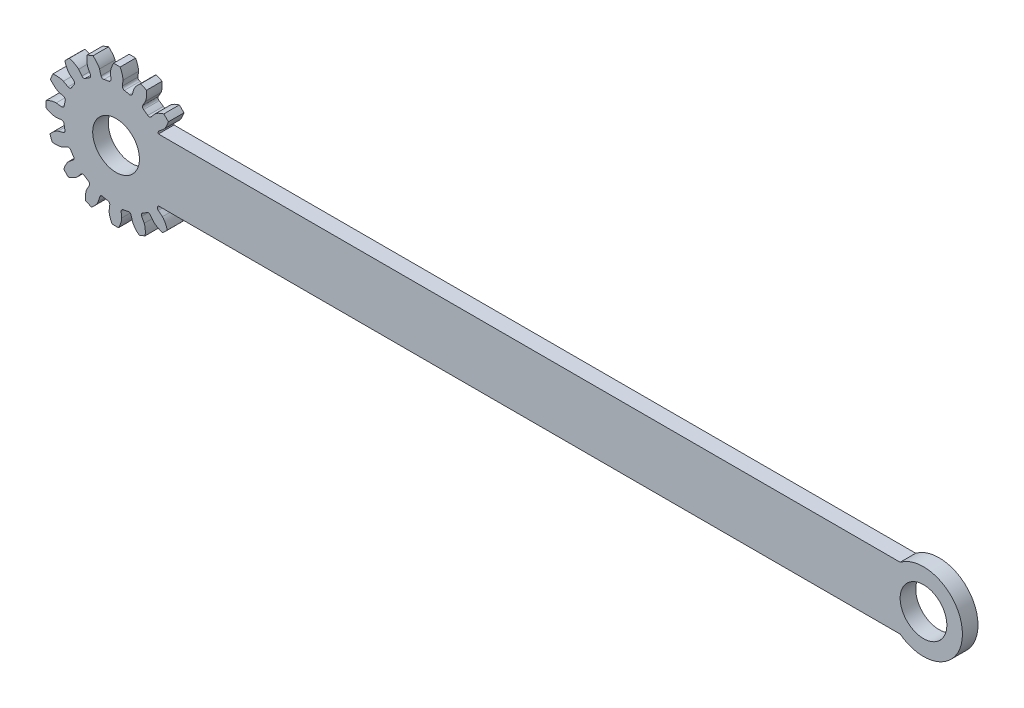
from build123d import *

# Parameters (mm, degrees)
BOSS_EXTRUDE1_DEPTH      = 3.175
CUT_EXTRUDE1_DEPTH       = 174.238840876
FILLET1_R                = 0.496244564
CIRPATTERN1_COUNT        = 16
FILLET1_OF_CIRPATTERN1_R = 0.496244564
SKETCH4_W                = 3.175
SKETCH4_H                = 12.7
BOSS_EXTRUDE2_DEPTH      = 5.08
SKETCH5_R                = 4.7625
CUT_EXTRUDE2_DEPTH       = 174.238840986


with BuildPart() as part:
    # Sketch1 → Boss-Extrude1 (new body)
    with BuildSketch(Plane.XY):
        with BuildLine():
            Line((12.798834175, -6.35), (159.919473719, -6.35))
            ThreePointArc((159.919473719, -6.35), (172.619473719, 0), (159.919473719, 6.35))
            Line((159.919473719, 6.35), (12.798834175, 6.35))
            ThreePointArc((12.798834175, 6.35), (-14.2875, 0), (12.798834175, -6.35))
        make_face()
    extrude(amount=BOSS_EXTRUDE1_DEPTH)

    # Sketch3 → Cut-Extrude1 (cut, through all)
    with BuildSketch(Plane.XY.offset(3.175)):
        with BuildLine():
            Line((10.304535783, 2.93958525), (11.823777189, 3.372980769))
            add(Edge.make_bspline(
                [(11.823777189, 3.372980769), (11.826828122, 3.373892569), (11.835350142, 3.376568337), (11.851321191, 3.382094065), (11.877172543, 3.391770902), (11.909795337, 3.405068504), (11.951582688, 3.42336192), (12.000307705, 3.446328962), (12.053311702, 3.473046741), (12.110372018, 3.503701368), (12.166747224, 3.535680762), (12.222457493, 3.568875739), (12.277469218, 3.603106176), (12.343518338, 3.645937307), (12.421890668, 3.699191843), (12.51225172, 3.764180094), (12.613236283, 3.84110705), (12.714502029, 3.922921917), (12.812770185, 4.006222816), (12.910423586, 4.093569134), (13.00374758, 4.180333952), (13.098951244, 4.273675723), (13.185952071, 4.361475552), (13.28145445, 4.463366885), (13.35795476, 4.546626366), (13.435301406, 4.635544323), (13.472697325, 4.679249473), (13.491703323, 4.70176538)],
                knots=[0, 0, 0, 0, 0, 0.005376749, 0.015083688, 0.02853182, 0.04661014, 0.064854849, 0.092110526, 0.119476176, 0.146842496, 0.174208854, 0.201574956, 0.228941013, 0.256307345, 0.307035032, 0.361767352, 0.416499661, 0.471231937, 0.525964282, 0.580696616, 0.635428982, 0.690161387, 0.744893688, 0.799626082, 0.854358407, 0.909090915, 0.909090915, 0.909090915, 0.909090915, 0.909090915], degree=4))
            ThreePointArc((13.491703323, 4.70176538), (14.043018272, 2.631785339), (14.278655565, 0.502644525))
            add(Edge.make_bspline(
                [(12.242763285, 1.137300936), (12.245937342, 1.137555753), (12.254849948, 1.138147388), (12.271738056, 1.138779756), (12.299339098, 1.139120368), (12.334563147, 1.138537862), (12.380138823, 1.136617047), (12.433873689, 1.132851889), (12.492955303, 1.127139941), (12.557243503, 1.119227096), (12.621372784, 1.109831304), (12.685322412, 1.099061646), (12.748995841, 1.087073853), (12.826071969, 1.071065653), (12.918409361, 1.049803624), (13.026170688, 1.021945252), (13.148157611, 0.986805116), (13.272176548, 0.947210583), (13.393939406, 0.905145435), (13.516594072, 0.85908679), (13.635002567, 0.812002506), (13.757544691, 0.759468213), (13.87043389, 0.709129536), (13.996350253, 0.648734026), (14.097807449, 0.59882535), (14.202102483, 0.543948644), (14.252786319, 0.516750416), (14.278655565, 0.502644525)],
                knots=[0, 0, 0, 0, 0, 0.005376749, 0.015083688, 0.02853182, 0.04661014, 0.064854849, 0.092110526, 0.119476176, 0.146842496, 0.174208854, 0.201574956, 0.228941013, 0.256307345, 0.307035032, 0.361767352, 0.416499661, 0.471231937, 0.525964282, 0.580696616, 0.635428982, 0.690161387, 0.744893688, 0.799626082, 0.854358407, 0.909090915, 0.909090915, 0.909090915, 0.909090915, 0.909090915], degree=4))
            Line((12.242763285, 1.137300936), (10.669686204, 0.991168727))
            ThreePointArc((10.669686204, 0.991168727), (10.532263704, 1.973839004), (10.304535783, 2.93958525))
        make_face()
    cut_extrude1 = extrude(amount=-CUT_EXTRUDE1_DEPTH, mode=Mode.SUBTRACT)

    # Fillet1
    fillet1_edges = [part.edges().sort_by_distance(p)[0] for p in [
        (10.304535783, 2.93958525, 1.5875),
        (10.669686204, 0.991168727, 1.5875),
    ]]
    fillet(fillet1_edges, radius=FILLET1_R)

    # CirPattern1: Cut-Extrude1 ×16 about axis
    cirpattern1_axis = Axis((0, 0, 3.175), (0, 0, 1))
    for i in range(1, CIRPATTERN1_COUNT):
        add(cut_extrude1.rotate(cirpattern1_axis, i * 360 / CIRPATTERN1_COUNT), mode=Mode.SUBTRACT)

    # Fillet1 of CirPattern1
    fillet1_of_cirpattern1_edges = [part.edges().sort_by_distance(p)[0] for p in [
        (8.395219128, 6.659197769, 1.5875),
        (9.478200852, 4.998832639, 1.5875),
        (5.207806465, 9.365007793, 1.5875),
        (6.84374534, 8.245469596, 1.5875),
        (1.227552476, 10.645080275, 1.5875),
        (3.167391638, 10.236808553, 1.5875),
        (-2.93958525, 10.304535783, 1.5875),
        (-0.991168727, 10.669686204, 1.5875),
        (-6.659197769, 8.395219128, 1.5875),
        (-4.998832639, 9.478200852, 1.5875),
        (-9.365007793, 5.207806465, 1.5875),
        (-8.245469596, 6.84374534, 1.5875),
        (-10.645080275, 1.227552476, 1.5875),
        (-10.236808553, 3.167391638, 1.5875),
        (-10.304535783, -2.93958525, 1.5875),
        (-10.669686204, -0.991168727, 1.5875),
        (-8.395219128, -6.659197769, 1.5875),
        (-9.478200852, -4.998832639, 1.5875),
        (-5.207806465, -9.365007793, 1.5875),
        (-6.84374534, -8.245469596, 1.5875),
        (-1.227552476, -10.645080275, 1.5875),
        (-3.167391638, -10.236808553, 1.5875),
        (2.93958525, -10.304535783, 1.5875),
        (0.991168727, -10.669686204, 1.5875),
        (6.659197769, -8.395219128, 1.5875),
        (4.998832639, -9.478200852, 1.5875),
        (9.365007793, -5.207806465, 1.5875),
        (8.245469596, -6.84374534, 1.5875),
        (10.645080275, -1.227552476, 1.5875),
        (10.236808553, -3.167391638, 1.5875),
    ]]
    fillet(fillet1_of_cirpattern1_edges, radius=FILLET1_OF_CIRPATTERN1_R)

    # Sketch4 → Boss-Extrude2 (add, symmetric)
    with BuildSketch(Plane(origin=(10.16, 0, 0), x_dir=(0, 0, -1), z_dir=(1, 0, 0))):
        with Locations((-1.5875, 0)):
            Rectangle(SKETCH4_W, SKETCH4_H)
    extrude(amount=BOSS_EXTRUDE2_DEPTH, both=True)

    # Sketch5 → Cut-Extrude2 (cut, through all)
    with BuildSketch(Plane.XY.offset(3.175)):
        Circle(SKETCH5_R)
        with Locations((164.681973719, 0)):
            Circle(SKETCH5_R)
    extrude(amount=-CUT_EXTRUDE2_DEPTH, mode=Mode.SUBTRACT)


solid = part.part
